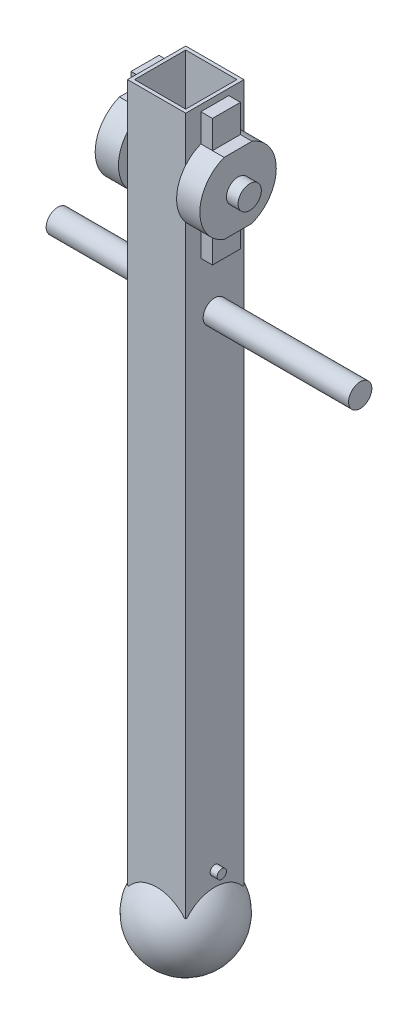
from build123d import *

# Parameters (mm, degrees)
SKETCH1_W                 = 25
SKETCH1_H                 = 25
BOSS_EXTRUDE1_DEPTH       = 300
SKETCH3_W                 = 22
SKETCH3_H                 = 22
CUT_EXTRUDE1_DEPTH        = 300
SKETCH6_R                 = 2
CUT_EXTRUDE3_DEPTH        = 25
SKETCH9_R                 = 1.99
BOSS_EXTRUDE8_DEPTH       = 28
SKETCH10_R                = 1.99
BOSS_EXTRUDE9_DEPTH       = 3
SKETCH11_R                = 5
BOSS_EXTRUDE10_DEPTH      = 10
SKETCH12_R                = 5
CUT_EXTRUDE4_DEPTH        = 1.5
SKETCH15_W                = 12
SKETCH15_H                = 12
CUT_EXTRUDE5_DEPTH        = 5
BOSS_EXTRUDE11_DEPTH      = 75
BOSS_EXTRUDE11_DEPTH_BACK = 55
SKETCH13_R                = 5
BOSS_EXTRUDE12_DEPTH      = 27.5
BOSS_EXTRUDE12_DEPTH_BACK = 22.5
SKETCH14_R                = 5


with BuildPart() as part:
    # Sketch1 → Boss-Extrude1 (new body)
    with BuildSketch(Plane(origin=(0, 0, 0), x_dir=(1, 0, 0), z_dir=(0, 1, 0))):
        Rectangle(SKETCH1_W, SKETCH1_H)
    extrude(amount=BOSS_EXTRUDE1_DEPTH)

    # Sketch3 → Cut-Extrude1 (cut)
    with BuildSketch(Plane.XZ):
        Rectangle(SKETCH3_W, SKETCH3_H)
    extrude(amount=-CUT_EXTRUDE1_DEPTH, mode=Mode.SUBTRACT)

    # Sketch4 → Revolve1 (revolve)
    with BuildSketch(Plane(origin=(0, -10, 0), x_dir=(-1, 0, 0), z_dir=(0, -1, 0))):
        with BuildLine():
            Line((0, 20), (0, -20))
            ThreePointArc((0, -20), (-20, 0), (0, 20))
        make_face()
    revolve(axis=Axis((0, -10, -13.212098256), (0, 0, 1)))

    # Sketch6 → Cut-Extrude3 (cut)
    with BuildSketch(Plane(origin=(12.5, 0, 0), x_dir=(0, 0, -1), z_dir=(1, 0, 0))):
        with Locations((0, 12)):
            Circle(SKETCH6_R)
    extrude(amount=-CUT_EXTRUDE3_DEPTH, mode=Mode.SUBTRACT)

    # Sketch12 → Cut-Extrude4 (cut)
    with BuildSketch(Plane(origin=(12.5, 0, 0), x_dir=(0, 0, -1), z_dir=(1, 0, 0))):
        with Locations((0, 270)):
            Circle(SKETCH12_R)
        with Locations((0, 220)):
            Circle(SKETCH12_R)
    cut_extrude4 = extrude(amount=-CUT_EXTRUDE4_DEPTH, mode=Mode.SUBTRACT)


with BuildPart() as body_2:
    # Sketch9 → Boss-Extrude8 (new body)
    with BuildSketch(Plane.ZY.offset(12.5)):
        with Locations((0, 12)):
            Circle(SKETCH9_R)
    extrude(amount=-BOSS_EXTRUDE8_DEPTH)

    # Sketch10 → Boss-Extrude9 (add)
    with BuildSketch(Plane.ZY.offset(12.5)):
        with Locations((0, 12)):
            Circle(SKETCH10_R)
    extrude(amount=BOSS_EXTRUDE9_DEPTH)


with BuildPart() as body_3:
    # Sketch11 → Boss-Extrude10 (new body)
    with BuildSketch(Plane(origin=(12.5, 0, 0), x_dir=(0, 0, -1), z_dir=(1, 0, 0))):
        with BuildLine():
            Line((6, 297.288884851), (-6, 297.288884851))
            Line((-6, 297.288884851), (-6, 285.288884851))
            ThreePointArc((-6, 285.288884851), (-16.424067706, 270), (-6, 254.711115149))
            Line((-6, 254.711115149), (-6, 242.711115149))
            Line((-6, 242.711115149), (6, 242.711115149))
            Line((6, 242.711115149), (6, 254.711115149))
            ThreePointArc((6, 254.711115149), (16.424067706, 270), (6, 285.288884851))
            Line((6, 285.288884851), (6, 297.288884851))
        make_face()
        with Locations((0, 270)):
            Circle(SKETCH11_R, mode=Mode.SUBTRACT)
    boss_extrude10 = extrude(amount=BOSS_EXTRUDE10_DEPTH)

    # Sketch15 → Cut-Extrude5 (cut)
    with BuildSketch(Plane(origin=(22.5, 0, 0), x_dir=(0, 0, -1), z_dir=(1, 0, 0))):
        with Locations((0, 248.711115149)):
            Rectangle(SKETCH15_W, SKETCH15_H)
        with Locations((0, 291.288884851)):
            Rectangle(SKETCH15_W, SKETCH15_H)
    cut_extrude5 = extrude(amount=-CUT_EXTRUDE5_DEPTH, mode=Mode.SUBTRACT)


with BuildPart() as part_1:
    add(part.part)

    # Mirror1: Boss-Extrude10, Cut-Extrude4, Cut-Extrude5 across plane
    add(boss_extrude10.mirror(Plane(origin=(0, 0, 0), x_dir=(0, 0, 1), z_dir=(1, 0, 0))))
    add(cut_extrude4.mirror(Plane(origin=(0, 0, 0), x_dir=(0, 0, 1), z_dir=(1, 0, 0))), mode=Mode.SUBTRACT)
    add(cut_extrude5.mirror(Plane(origin=(0, 0, 0), x_dir=(0, 0, 1), z_dir=(1, 0, 0))), mode=Mode.SUBTRACT)

    # Sketch13 → Boss-Extrude11 (add, two sides: drawn at the far end of the back side and taken through both)
    with BuildSketch(Plane(origin=(0, 0, 0), x_dir=(0, 0, -1), z_dir=(1, 0, 0)).offset(-BOSS_EXTRUDE11_DEPTH_BACK)):
        with Locations((0, 220)):
            Circle(SKETCH13_R)
    extrude(amount=BOSS_EXTRUDE11_DEPTH + BOSS_EXTRUDE11_DEPTH_BACK)

    # Sketch14 → Boss-Extrude12 (add, two sides: drawn at the far end of the back side and taken through both)
    with BuildSketch(Plane(origin=(0, 0, 0), x_dir=(0, 0, -1), z_dir=(1, 0, 0)).offset(-BOSS_EXTRUDE12_DEPTH_BACK)):
        with Locations((0, 270)):
            Circle(SKETCH14_R)
    extrude(amount=BOSS_EXTRUDE12_DEPTH + BOSS_EXTRUDE12_DEPTH_BACK)


solid = Compound([body_2.part, body_3.part, part_1.part])
